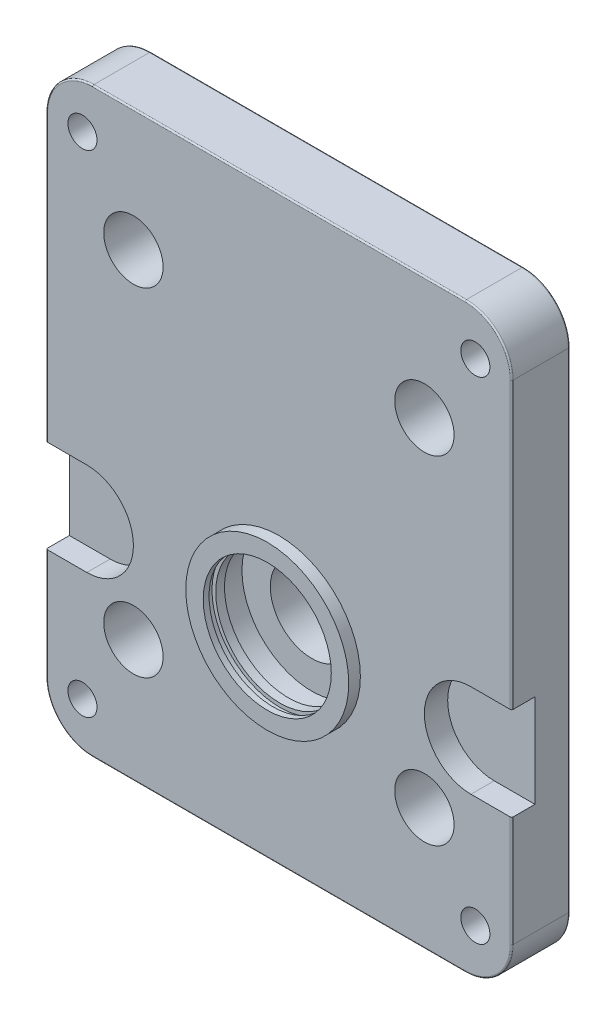
from build123d import *

# Parameters (mm, degrees)
BOSS_EXTRUDE1_DEPTH            = 2
BOSS_EXTRUDE2_DEPTH            = 10
CUT_EXTRUDE1_START             = 10
CUT_EXTRUDE1_DEPTH             = 4
CUT_EXTRUDE2_START             = 10
SKETCH1_5_R                    = 11
CUT_EXTRUDE2_DEPTH             = 4
F_14_25_14_25_DIAMETER_HOLE1_D = 14.25
F_5_0_5_DIAMETER_HOLE1_D       = 5
F_5_0_5_DIAMETER_HOLE1_DEPTH   = 10
F_10_2_10_2_DIAMETER_HOLE1_D   = 10.2
EXTRUDE_THIN1_START            = 12
SKETCH1_6_R                    = 14
SKETCH1_6_R_2                  = 11
EXTRUDE_THIN1_DEPTH            = 2
SKETCH8_W                      = 1.15
SKETCH8_H                      = 11.65
SKETCH8_W_2                    = 4
SKETCH8_H_2                    = 12
FILLET1_R                      = 0.5
FILLET2_R                      = 5
FILLET3_R                      = 0.25
CUT_EXTRUDE_THIN1_START        = -2
CUT_EXTRUDE_THIN1_DEPTH        = 1
F_3_0_3_DIAMETER_HOLE1_D       = 3
F_3_0_3_DIAMETER_HOLE1_DEPTH   = 2
F_3_0_3_DIAMETER_HOLE1_TIP     = 0.901290929


with BuildPart() as part:
    # Sketch1 → Boss-Extrude1 (new body)
    with BuildSketch(Plane.XY):
        Polygon((15, 45), (-15, 45), (-35, 40), (-35, 25), (-37, 25), (-37, -25), (-35, -25), (-35, -40), (-15, -45), (15, -45), (35, -40), (35, -25), (37, -25), (37, 25), (35, 25), (35, 40), align=None)
    extrude(amount=-BOSS_EXTRUDE1_DEPTH)

    # Sketch1<3> → Boss-Extrude2 (add)
    with BuildSketch(Plane.XY):
        with BuildLine():
            Line((32, 50), (-32, 50))
            ThreePointArc((-32, 50), (-37.656854249, 47.656854249), (-40, 42))
            Line((-40, 42), (-40, -42))
            ThreePointArc((-40, -42), (-37.656854249, -47.656854249), (-32, -50))
            Line((-32, -50), (32, -50))
            ThreePointArc((32, -50), (37.656854249, -47.656854249), (40, -42))
            Line((40, -42), (40, 42))
            ThreePointArc((40, 42), (37.656854249, 47.656854249), (32, 50))
        make_face()
    extrude(amount=BOSS_EXTRUDE2_DEPTH)

    # Sketch1<4> → Cut-Extrude1 (cut)
    with BuildSketch(Plane.XY.offset(CUT_EXTRUDE1_START)):
        with BuildLine():
            Line((33, -7), (41, -7))
            ThreePointArc((41, -7), (49, -15), (41, -23))
            Line((41, -23), (33, -23))
            ThreePointArc((33, -23), (25, -15), (33, -7))
        make_face()
        with BuildLine():
            Line((-33, -7), (-41, -7))
            ThreePointArc((-41, -7), (-49, -15), (-41, -23))
            Line((-41, -23), (-33, -23))
            ThreePointArc((-33, -23), (-25, -15), (-33, -7))
        make_face()
    extrude(amount=-CUT_EXTRUDE1_DEPTH, mode=Mode.SUBTRACT)

    # Sketch1<5> → Cut-Extrude2 (cut)
    with BuildSketch(Plane.XY.offset(CUT_EXTRUDE2_START)):
        with Locations(Location((0, -15, 0), (0, 0, 180))):
            Circle(SKETCH1_5_R)
    extrude(amount=-CUT_EXTRUDE2_DEPTH, mode=Mode.SUBTRACT)

    # Ø14.25 (14.25) Diameter Hole1 (through all)
    with Locations(Plane.XY.offset(10)):
        with Locations((0, -15)):
            Hole(F_14_25_14_25_DIAMETER_HOLE1_D / 2)

    # Ø5.0 (5) Diameter Hole1
    with Locations(Plane.XY.offset(10)):
        with Locations((-33.753049524, 42.191311906), (33.753049524, 42.191311906), (33.753049524, -42.191311906), (-33.753049524, -42.191311906)):
            Hole(F_5_0_5_DIAMETER_HOLE1_D / 2, depth=F_5_0_5_DIAMETER_HOLE1_DEPTH)

    # Ø10.2 (10.2) Diameter Hole1 (through all)
    with Locations(Plane.XY.offset(10)):
        with Locations((-25, 29), (25, 29), (25, -29), (-25, -29)):
            Hole(F_10_2_10_2_DIAMETER_HOLE1_D / 2)

    # Sketch1<6> → Extrude-Thin1 (add)
    with BuildSketch(Plane.XY.offset(EXTRUDE_THIN1_START)):
        with Locations((0, -15)):
            Circle(SKETCH1_6_R)
        with Locations((0, -15)):
            Circle(SKETCH1_6_R_2, mode=Mode.SUBTRACT)
    extrude(amount=-EXTRUDE_THIN1_DEPTH)

    # Sketch8 → Cut-Revolve1 (revolve, cut)
    with BuildSketch(Plane(origin=(0, 0, 0), x_dir=(0, 0, -1), z_dir=(1, 0, 0)), mode=Mode.PRIVATE) as cut_revolve1_sk:
        with Locations((-10.425, -9.175)):
            Rectangle(SKETCH8_W, SKETCH8_H)
        with Locations((-6.35, -9)):
            Rectangle(SKETCH8_W_2, SKETCH8_H_2)
    revolve(cut_revolve1_sk.sketch.rotate(Axis((0, -15, 0), (0, 0, 1)), 270), axis=Axis((0, -15, 0), (0, 0, 1)), mode=Mode.SUBTRACT)

    # Fillet1
    fillet1_edges = [part.edges().sort_by_distance(p)[0] for p in [
        (-35, 25, -1),
        (35, 25, -1),
        (37, 25, -1),
        (37, -25, -1),
        (35, -25, -1),
        (-35, -25, -1),
        (-37, -25, -1),
        (-37, 25, -1),
    ]]
    fillet(fillet1_edges, radius=FILLET1_R)

    # Fillet2
    # the kernel refuses this fillet: 5 mm, written as the material it takes off along each edge
    with BuildSketch(Plane(origin=(-35, 40, 0), x_dir=(0.970142500145332, 0.24253562503633277, 0), z_dir=(0, 0, -1)), Plane(origin=(35, 40, 0), x_dir=(0, -1, 0), z_dir=(0, 0, -1))) as fillet2_piece_1:
        with BuildLine():
            CenterArc((FILLET2_R * 0.780776406404, FILLET2_R), FILLET2_R, 194.036243468, 75.963756532)
            Line((-FILLET2_R * 0.189366093741, FILLET2_R * 0.757464374964), (0, 0))
            Line((0, 0), (FILLET2_R * 0.780776406404, 0))
        make_face()
    extrude(amount=11.75970508, mode=Mode.SUBTRACT)
    with BuildSketch(Plane(origin=(-15, 45, 0), x_dir=(1, 0, 0), z_dir=(0, 0, -1)), Plane(origin=(15, 45, 0), x_dir=(0.9701425001453312, -0.2425356250363357, 0), z_dir=(0, 0, -1))) as fillet2_piece_2:
        with BuildLine():
            CenterArc((FILLET2_R * 0.123105625618, FILLET2_R), FILLET2_R, 255.963756532, 14.036243468)
            Line((-FILLET2_R * 0.119429999419, FILLET2_R * 0.0298574998547), (0, 0))
            Line((0, 0), (FILLET2_R * 0.123105625618, 0))
        make_face()
    extrude(amount=3.53882032, mode=Mode.SUBTRACT)
    with BuildSketch(Plane(origin=(35, -40, 0), x_dir=(0, 1, 0), z_dir=(0, 0, -1)), Plane(origin=(-35, -40, 0), x_dir=(0.9701425001453319, -0.24253562503633297, 0), z_dir=(0, 0, -1))) as fillet2_piece_3:
        with BuildLine():
            CenterArc((FILLET2_R * 0.780776406404, -FILLET2_R), FILLET2_R, 90, 75.963756532)
            Line((-FILLET2_R * 0.189366093741, -FILLET2_R * 0.757464374964), (0, 0))
            Line((0, 0), (FILLET2_R * 0.780776406404, 0))
        make_face()
    extrude(amount=11.75970508, mode=Mode.SUBTRACT)
    with BuildSketch(Plane(origin=(15, -45, 0), x_dir=(0.9701425001453312, 0.2425356250363357, 0), z_dir=(0, 0, -1)), Plane(origin=(-15, -45, 0), x_dir=(1, 0, 0), z_dir=(0, 0, -1))) as fillet2_piece_4:
        with BuildLine():
            CenterArc((FILLET2_R * 0.123105625618, -FILLET2_R), FILLET2_R, 90, 14.036243468)
            Line((-FILLET2_R * 0.119429999419, -FILLET2_R * 0.0298574998547), (0, 0))
            Line((0, 0), (FILLET2_R * 0.123105625618, 0))
        make_face()
    extrude(amount=3.53882032, mode=Mode.SUBTRACT)

    # Fillet3
    fillet3_edges = [part.edges().sort_by_distance(p)[0] for p in [
        (23.404914061, 42.898771485, 0),
        (0, 45, 0),
        (-23.404914061, 42.898771485, 0),
        (31.442974512, 40.883374443, 0),
        (14.99538819, 44.962537783, 0),
        (-14.99538819, 44.962537783, 0),
        (-31.442974512, 40.883374443, 0),
        (37.656854249, 47.656854249, 10),
        (0, 50, 0),
        (-37.656854249, 47.656854249, 0),
        (-40, 0, 0),
        (-37.656854249, -47.656854249, 10),
        (0, -50, 10),
        (37.656854249, -47.656854249, 10),
        (40, 17.5, 10),
        (0, 50, 10),
        (-37.656854249, 47.656854249, 10),
        (-40, 17.5, 10),
        (37.656854249, 47.656854249, 0),
        (40, 0, 0),
        (37.656854249, -47.656854249, 0),
        (0, -50, 0),
        (-37.656854249, -47.656854249, 0),
        (-40, -32.5, 10),
        (40, -32.5, 10),
    ]]
    fillet(fillet3_edges, radius=FILLET3_R)

    # Sketch1<8> → Cut-Extrude-Thin1 (cut)
    with BuildSketch(Plane.XY.offset(CUT_EXTRUDE_THIN1_START)):
        with BuildLine():
            Line((22, 15), (22, -15))
            ThreePointArc((22, -15), (0, -37), (-22, -15))
            Line((-22, -15), (-22, 15))
            ThreePointArc((-22, 15), (0, 37), (22, 15))
        make_face()
        with BuildLine():
            Line((20, 15), (20, -15))
            ThreePointArc((20, -15), (0, -35), (-20, -15))
            Line((-20, -15), (-20, 15))
            ThreePointArc((-20, 15), (0, 35), (20, 15))
        make_face(mode=Mode.SUBTRACT)
    extrude(amount=CUT_EXTRUDE_THIN1_DEPTH, mode=Mode.SUBTRACT)

    # Ø3.0 (3) Diameter Hole1
    with Locations(Plane(origin=(0, 0, -2), x_dir=(-1, 0, 0), z_dir=(0, 0, -1))):
        with Locations((0, 40), (0, -40)):
            Hole(F_3_0_3_DIAMETER_HOLE1_D / 2, depth=F_3_0_3_DIAMETER_HOLE1_DEPTH)
            with Locations((0, 0, -(F_3_0_3_DIAMETER_HOLE1_DEPTH + F_3_0_3_DIAMETER_HOLE1_TIP / 2))):  # 118° drill point
                Cone(0, F_3_0_3_DIAMETER_HOLE1_D / 2, F_3_0_3_DIAMETER_HOLE1_TIP, mode=Mode.SUBTRACT)


solid = part.part
